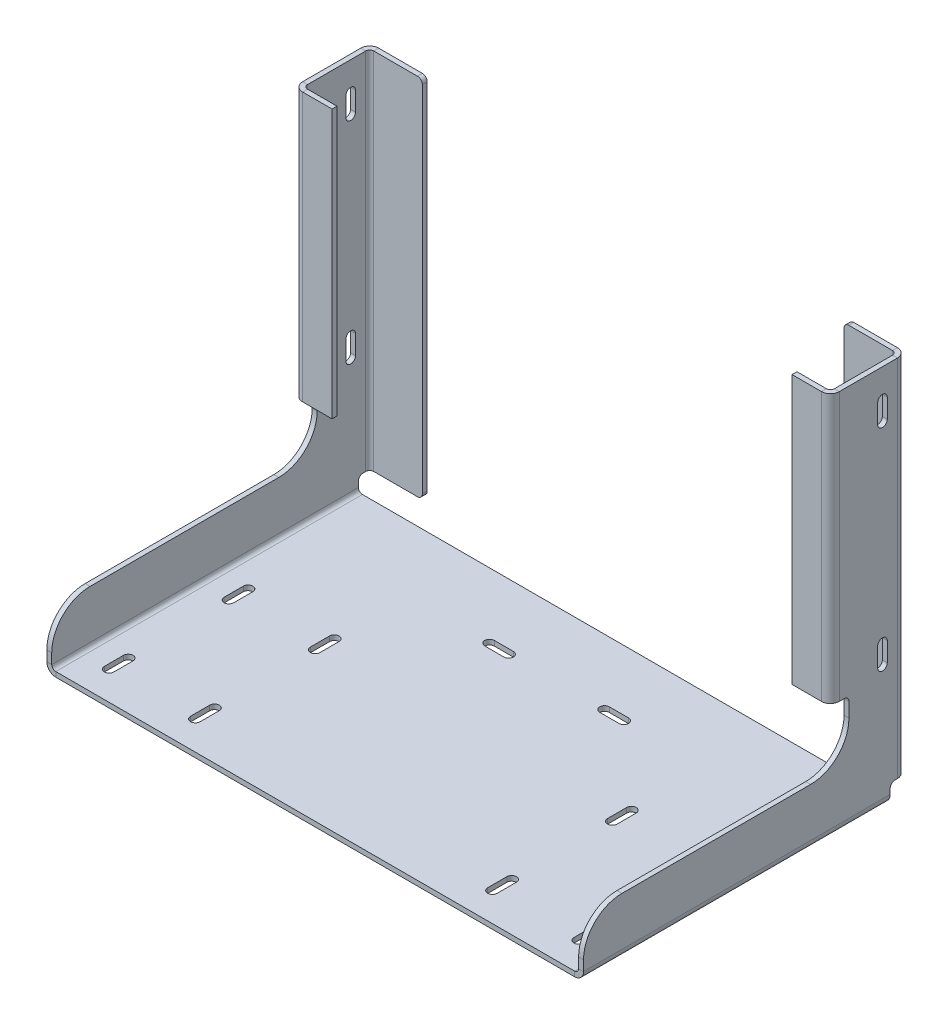
from build123d import *

# Parameters (mm, degrees)
SKETCH1_W                       = 355.6
SKETCH1_H                       = 203.2
BASE_FLANGE1_DEPTH              = 3.2639
EDGE_FLANGE1_STRIP_W            = 18.36928
EDGE_FLANGE1_STRIP_H            = 3.2639
EDGE_FLANGE1_STRIP_CUT_DEPTH    = 203.2
EDGE_FLANGE1_DEPTH              = 203.2
EDGE_FLANGE2_DEPTH              = 241.3
CUT_EXTRUDE1_DEPTH              = 450.37928505
EDGE_FLANGE3_DEPTH              = 177.8
EDGE_FLANGE3_BEND_DEPTH         = 177.8
FILLET1_R                       = 3.175
F_1_4_START                     = -177.8
F_1_4_0_25_DIAMETER_SLOT1_DEPTH = 355.6
F_1_4_START_2                   = -3.2639
F_1_4_0_25_DIAMETER_SLOT2_DEPTH = 3.2639
F_1_4_0_25_DIAMETER_SLOT3_DEPTH = 3.2639


# Read off the part's stored shape, not the designer's step: 1/4 (0.25) Diameter Slot1, 1/4 (0.25) Diameter Slot2, 1/4 (0.25) Diameter Slot3
# Sheet-metal steps are written as plain solids
with BuildPart() as part:
    # Sketch1 → Base-Flange1 (new body)
    with BuildSketch(Plane(origin=(0, 0, 0), x_dir=(1, 0, 0), z_dir=(0, 1, 0))):
        Rectangle(SKETCH1_W, SKETCH1_H)
    extrude(amount=-BASE_FLANGE1_DEPTH)

    # Edge-Flange1 strip (across the edge) → Edge-Flange1 strip cut (cut)
    with BuildSketch(Plane(origin=(177.8, 0, 101.6), x_dir=(-1, 0, 0), z_dir=(0, 0, -1))):
        with Locations((-3.2639, -1.63195)):
            Rectangle(EDGE_FLANGE1_STRIP_W, EDGE_FLANGE1_STRIP_H)
    edge_flange1_strip_cut = extrude(amount=EDGE_FLANGE1_STRIP_CUT_DEPTH, mode=Mode.SUBTRACT)

    # Edge-Flange1 section (across the edge) → Edge-Flange1 (add)
    with BuildSketch(Plane(origin=(177.8, 0, 101.6), x_dir=(-1, 0, 0), z_dir=(0, 0, -1))):
        with BuildLine():
            Line((0, 2.65684), (0, 250.7361))
            Line((0, 250.7361), (3.2639, 250.7361))
            Line((3.2639, 250.7361), (3.2639, 2.65684))
            ThreePointArc((3.2639, 2.65684), (4.042070419, 0.778170419), (5.92074, 0))
            Line((5.92074, 0), (5.92074, -3.2639))
            ThreePointArc((5.92074, -3.2639), (1.734144596, -1.529755404), (0, 2.65684))
        make_face()
    edge_flange1 = extrude(amount=EDGE_FLANGE1_DEPTH)

    # Edge-Flange2 section (across the edge) → Edge-Flange2 (add)
    with BuildSketch(Plane(origin=(174.5361, 250.7361, -109.08284), x_dir=(0, 0, 1), z_dir=(0, -1, 0))):
        with BuildLine():
            Line((-3.2639, 2.65684), (-3.2639, 34.8361))
            Line((-3.2639, 34.8361), (0, 34.8361))
            Line((0, 34.8361), (0, 2.65684))
            ThreePointArc((0, 2.65684), (0.778170419, 0.778170419), (2.65684, 0))
            Line((2.65684, 0), (7.48284, 0))
            Line((7.48284, 0), (7.48284, -3.2639))
            Line((7.48284, -3.2639), (2.65684, -3.2639))
            ThreePointArc((2.65684, -3.2639), (-1.529755404, -1.529755404), (-3.2639, 2.65684))
        make_face()
    edge_flange2 = extrude(amount=EDGE_FLANGE2_DEPTH)

    # Sketch14 → Cut-Extrude1 (cut, through all)
    with BuildSketch(Plane(origin=(177.8, 0, 0), x_dir=(0, 0, -1), z_dir=(1, 0, 0))):
        with BuildLine():
            Line((74.24674, 250.7361), (74.24674, 60.2361))
            ThreePointArc((74.24674, 60.2361), (66.807252242, 42.275587758), (48.84674, 34.8361))
            Line((48.84674, 34.8361), (-76.2, 34.8361))
            ThreePointArc((-76.2, 34.8361), (-94.160512242, 27.396612242), (-101.6, 9.4361))
            Line((-101.6, 9.4361), (-101.6, 250.7361))
            Line((-101.6, 250.7361), (74.24674, 250.7361))
        make_face()
    cut_extrude1 = extrude(amount=-CUT_EXTRUDE1_DEPTH, mode=Mode.SUBTRACT)

    # Mirror1: Edge-Flange1 strip cut, Edge-Flange1, Edge-Flange2, Cut-Extrude1 across plane
    add(edge_flange1_strip_cut.mirror(Plane(origin=(0, 0, 0), x_dir=(0, 0, 1), z_dir=(1, 0, 0))), mode=Mode.SUBTRACT)
    add(edge_flange1.mirror(Plane(origin=(0, 0, 0), x_dir=(0, 0, 1), z_dir=(1, 0, 0))))
    add(edge_flange2.mirror(Plane(origin=(0, 0, 0), x_dir=(0, 0, 1), z_dir=(1, 0, 0))))
    add(cut_extrude1.mirror(Plane(origin=(0, 0, 0), x_dir=(0, 0, 1), z_dir=(1, 0, 0))), mode=Mode.SUBTRACT)

    # Edge-Flange3 section (across the edge) → Edge-Flange3 (add)
    with BuildSketch(Plane(origin=(174.5361, 72.9361, -65.2399), x_dir=(0, 0, -1), z_dir=(0, 1, 0))):
        with BuildLine():
            Line((-3.2639, 2.65684), (-3.2639, 22.1361))
            Line((-3.2639, 22.1361), (0, 22.1361))
            Line((0, 22.1361), (0, 2.65684))
            ThreePointArc((0, 2.65684), (0.778170419, 0.778170419), (2.65684, 0))
            Line((2.65684, 0), (9.00684, 0))
            Line((9.00684, 0), (9.00684, -3.2639))
            Line((9.00684, -3.2639), (2.65684, -3.2639))
            ThreePointArc((2.65684, -3.2639), (-1.529755404, -1.529755404), (-3.2639, 2.65684))
        make_face()
    extrude(amount=EDGE_FLANGE3_DEPTH)

    # Edge-Flange3 section 2 (across the edge) → Edge-Flange3 bend (add)
    with BuildSketch(Plane(origin=(-174.5361, 250.7361, -65.2399), x_dir=(0, 0, -1), z_dir=(0, -1, 0))):
        with BuildLine():
            Line((-3.2639, 2.65684), (-3.2639, 22.1361))
            Line((-3.2639, 22.1361), (0, 22.1361))
            Line((0, 22.1361), (0, 2.65684))
            ThreePointArc((0, 2.65684), (0.778170419, 0.778170419), (2.65684, 0))
            Line((2.65684, 0), (9.00684, 0))
            Line((9.00684, 0), (9.00684, -3.2639))
            Line((9.00684, -3.2639), (2.65684, -3.2639))
            ThreePointArc((2.65684, -3.2639), (-1.529755404, -1.529755404), (-3.2639, 2.65684))
        make_face()
    extrude(amount=EDGE_FLANGE3_BEND_DEPTH)

    # Fillet1
    fillet1_edges = [part.edges().sort_by_distance(p)[0] for p in [
        (-176.16805, 9.4361, -101.6),
        (-139.7, 9.4361, -110.71479),
        (-139.7, 250.7361, -110.71479),
        (176.16805, 72.9361, -74.24674),
        (-176.16805, 72.9361, -74.24674),
        (176.16805, 9.4361, -101.6),
        (139.7, 250.7361, -110.71479),
        (139.7, 9.4361, -110.71479),
    ]]
    fillet(fillet1_edges, radius=FILLET1_R)

    # 1/4 (0.25) Diameter Slot1 outline → 1/4 (0.25) Diameter Slot1 (cut)
    with BuildSketch(Plane.YZ.offset(F_1_4_START)):
        with BuildLine():
            Line((79.2861, -99.64674), (91.9861, -99.64674))
            ThreePointArc((91.9861, -99.64674), (95.1611, -96.47174), (91.9861, -93.29674))
            Line((91.9861, -93.29674), (79.2861, -93.29674))
            ThreePointArc((79.2861, -93.29674), (76.1111, -96.47174), (79.2861, -99.64674))
        make_face()
        with BuildLine():
            ThreePointArc((231.6861, -99.64674), (234.8611, -96.47174), (231.6861, -93.29674))
            Line((231.6861, -93.29674), (218.9861, -93.29674))
            ThreePointArc((218.9861, -93.29674), (215.8111, -96.47174), (218.9861, -99.64674))
            Line((218.9861, -99.64674), (231.6861, -99.64674))
        make_face()
    extrude(amount=F_1_4_0_25_DIAMETER_SLOT1_DEPTH, mode=Mode.SUBTRACT)

    # 1/4 (0.25) Diameter Slot2 outline → 1/4 (0.25) Diameter Slot2 (cut)
    with BuildSketch(Plane(origin=(0, 0, 0), x_dir=(1, 0, 0), z_dir=(0, 1, 0)).offset(F_1_4_START_2)):
        with BuildLine():
            ThreePointArc((95.25, -3.175), (98.425, -6.35), (101.6, -3.175))
            Line((101.6, -3.175), (101.6, 9.525))
            ThreePointArc((101.6, 9.525), (98.425, 12.7), (95.25, 9.525))
            Line((95.25, 9.525), (95.25, -3.175))
        make_face()
        with BuildLine():
            ThreePointArc((101.6, -69.85), (98.425, -66.675), (95.25, -69.85))
            Line((95.25, -69.85), (95.25, -82.55))
            ThreePointArc((95.25, -82.55), (98.425, -85.725), (101.6, -82.55))
            Line((101.6, -82.55), (101.6, -69.85))
        make_face()
        with BuildLine():
            ThreePointArc((158.75, -69.85), (155.575, -66.675), (152.4, -69.85))
            Line((152.4, -69.85), (152.4, -82.55))
            ThreePointArc((152.4, -82.55), (155.575, -85.725), (158.75, -82.55))
            Line((158.75, -82.55), (158.75, -69.85))
        make_face()
        with BuildLine():
            ThreePointArc((158.75, 9.525), (155.575, 12.7), (152.4, 9.525))
            Line((152.4, 9.525), (152.4, -3.175))
            ThreePointArc((152.4, -3.175), (155.575, -6.35), (158.75, -3.175))
            Line((158.75, -3.175), (158.75, 9.525))
        make_face()
    f_1_4_0_25_diameter_slot2 = extrude(amount=F_1_4_0_25_DIAMETER_SLOT2_DEPTH, mode=Mode.SUBTRACT)

    # Mirror2: 1/4 (0.25) Diameter Slot2 across plane
    add(f_1_4_0_25_diameter_slot2.mirror(Plane(origin=(0, 0, 0), x_dir=(0, 0, 1), z_dir=(1, 0, 0))), mode=Mode.SUBTRACT)

    # 1/4 (0.25) Diameter Slot3 outline → 1/4 (0.25) Diameter Slot3 (cut)
    with BuildSketch(Plane(origin=(0, 0, 0), x_dir=(1, 0, 0), z_dir=(0, 1, 0)).offset(F_1_4_START_2)):
        with BuildLine():
            ThreePointArc((-44.45, 61.54674), (-47.625, 58.37174), (-44.45, 55.19674))
            Line((-44.45, 55.19674), (-31.75, 55.19674))
            ThreePointArc((-31.75, 55.19674), (-28.575, 58.37174), (-31.75, 61.54674))
            Line((-31.75, 61.54674), (-44.45, 61.54674))
        make_face()
        with BuildLine():
            ThreePointArc((44.45, 55.19674), (47.625, 58.37174), (44.45, 61.54674))
            Line((44.45, 61.54674), (31.75, 61.54674))
            ThreePointArc((31.75, 61.54674), (28.575, 58.37174), (31.75, 55.19674))
            Line((31.75, 55.19674), (44.45, 55.19674))
        make_face()
    extrude(amount=F_1_4_0_25_DIAMETER_SLOT3_DEPTH, mode=Mode.SUBTRACT)


solid = part.part
